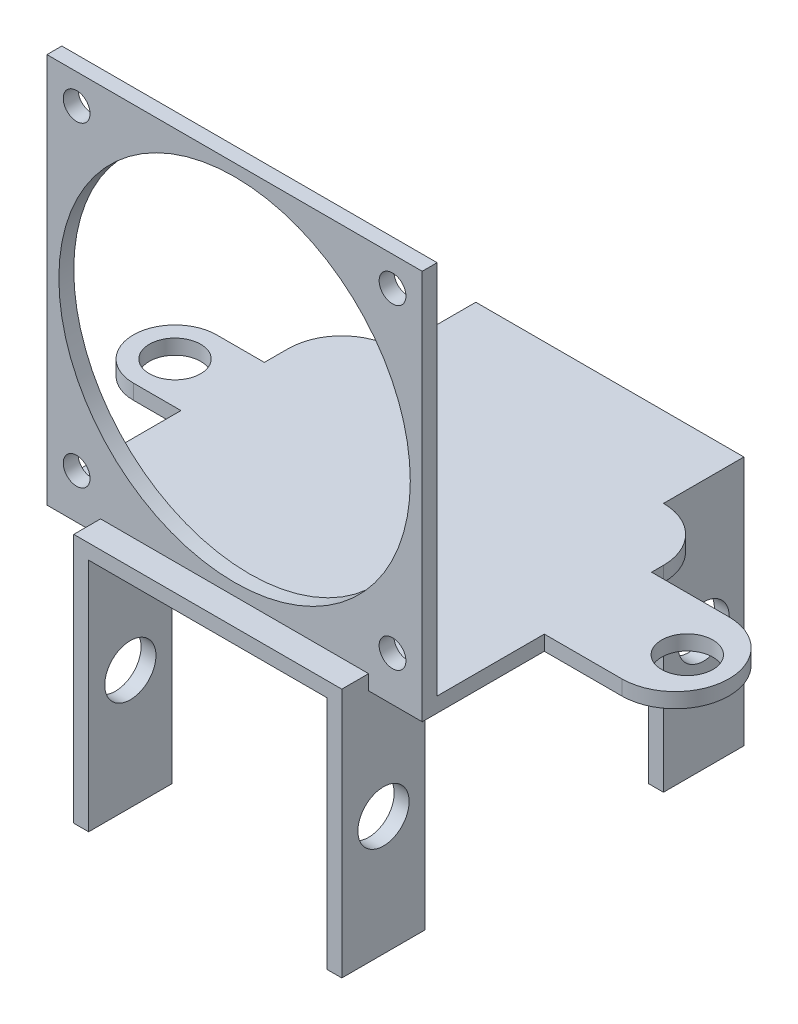
from build123d import *

# Parameters (mm, degrees)
SKETCH_1_R           = 29.5
SKETCH_1_R_2         = 2.25
EXTRUDE_1_DEPTH      = 2.5
EXTRUDE_2_DEPTH      = 2.5
SKETCH_3_W           = 2.5
SKETCH_3_H           = 20.5
SKETCH_3_H_2         = 29.5
EXTRUDE_3_DEPTH      = 42
SKETCH_4_W           = 15.5
SKETCH_4_H           = 42
SKETCH_4_W_2         = 6
CUT_EXTRUDE_1_DEPTH  = 60
SKETCH_5_R           = 4.3
EXTRUDE_4_DEPTH      = 2.5
CUT_EXTRUDE_9_DEPTH  = 122.813381989
EXTRUDE_6_DEPTH      = 2.5
SKETCH_14_R          = 4.3
CUT_EXTRUDE_10_DEPTH = 118.573381341
FILLET_3_R           = 9


with BuildPart() as part:
    # 草图1 → 凸台-拉伸1 (new body)
    with BuildSketch(Plane.XY):
        Polygon((0, 31.5), (31.5, 31.5), (31.5, -34), (-31.5, -34), (-31.5, 31.5), align=None)
        Circle(SKETCH_1_R, mode=Mode.SUBTRACT)
        with Locations((-26.516504294, 26.516504294)):
            Circle(SKETCH_1_R_2, mode=Mode.SUBTRACT)
        with Locations((26.516504294, 26.516504294)):
            Circle(SKETCH_1_R_2, mode=Mode.SUBTRACT)
        with Locations((26.516504294, -26.516504294)):
            Circle(SKETCH_1_R_2, mode=Mode.SUBTRACT)
        with Locations((-26.516504294, -26.516504294)):
            Circle(SKETCH_1_R_2, mode=Mode.SUBTRACT)
    extrude(amount=EXTRUDE_1_DEPTH)

    # 草图2 → 凸台-拉伸2 (add)
    with BuildSketch(Plane(origin=(0, -34, 0), x_dir=(1, 0, 0), z_dir=(0, 1, 0))):
        Polygon((-31.5, 46.5), (-31.5, -2.5), (-20, -2.5), (-20, -22.5), (20, -22.5), (20, -2.5), (31.5, -2.5), (31.5, 46.5), (20, 46.5), (20, 66.5), (-20, 66.5), (-20, 46.5), align=None)
    extrude(amount=EXTRUDE_2_DEPTH)

    # 草图3 → 凸台-拉伸3 (add)
    with BuildSketch(Plane(origin=(0, -31.5, 0), x_dir=(1, 0, 0), z_dir=(0, 1, 0))):
        with Locations((21.25, 56.25)):
            Rectangle(SKETCH_3_W, SKETCH_3_H)
        with Locations((-21.25, 56.25)):
            Rectangle(SKETCH_3_W, SKETCH_3_H)
        with Locations((-21.25, -7.75)):
            Rectangle(SKETCH_3_W, SKETCH_3_H_2)
        with Locations((21.25, -7.75)):
            Rectangle(SKETCH_3_W, SKETCH_3_H_2)
    extrude(amount=-EXTRUDE_3_DEPTH)

    # 草图4 → 切除-拉伸1 (cut)
    with BuildSketch(Plane.ZY.offset(22.5)):
        with Locations((14.75, -52.5)):
            Rectangle(SKETCH_4_W, SKETCH_4_H)
        with Locations((-63.5, -52.5)):
            Rectangle(SKETCH_4_W_2, SKETCH_4_H)
    extrude(amount=-CUT_EXTRUDE_1_DEPTH, mode=Mode.SUBTRACT)

    # 草图5 → 凸台-拉伸4 (add)
    # profile 1 of 2: a face of its own
    with BuildSketch(Plane(origin=(0, -31.5, 0), x_dir=(1, 0, 0), z_dir=(0, 1, 0))):
        with BuildLine():
            Line((-31.5, 33.999994356), (-39.5, 33.999994356))
            ThreePointArc((-39.5, 33.999994356), (-46.499999777, 27.00176014), (-39.503531569, 19.999995247))
            Line((-39.503531569, 19.999995247), (-31.5, 19.999995247))
            Line((-31.5, 19.999995247), (-31.5, 33.999994356))
        make_face()
        with Locations(Location((-39.5, 26.999994356, 0), (0, 0, 270))):
            Circle(SKETCH_5_R, mode=Mode.SUBTRACT)
    # profile 2 of 2: a face of its own
    with BuildSketch(Plane(origin=(0, -31.5, 0), x_dir=(1, 0, 0), z_dir=(0, 1, 0))):
        with BuildLine():
            Line((44.500000207, 35.999994356), (31.5, 35.999994356))
            Line((31.5, 35.999994356), (31.5, 26.5))
            Line((31.5, 26.5), (31.5, 17.999994356))
            Line((31.5, 17.999994356), (44.500000207, 17.999994356))
            ThreePointArc((44.500000207, 17.999994356), (53.500000207, 26.999994356), (44.500000207, 35.999994356))
        make_face()
        with Locations(Location((46.5, 26.999994356, 0), (0, 0, 270))):
            Circle(SKETCH_5_R, mode=Mode.SUBTRACT)
    extrude(amount=-EXTRUDE_4_DEPTH)

    # 草图12 → 切除-拉伸9 (cut, through all)
    with BuildSketch(Plane.ZY.offset(22.5)):
        Polygon((-46, -73.5), (-47, -73.5), (-47, -31.5), (-46.5, -31.5), (-46, -31.5), align=None)
    extrude(amount=-CUT_EXTRUDE_9_DEPTH, mode=Mode.SUBTRACT)


with BuildPart() as cut_extrude_9_piece_1:
    # of the separate pieces the step leaves, piece 1, a body of its own (cut_extrude_9_pieces)
    add(part.part.solids().sort_by_distance((31.5, 31.5, 0))[0])



with BuildPart() as cut_extrude_9_piece_2:
    # of the separate pieces the step leaves, piece 2, a body of its own (cut_extrude_9_pieces)
    add(part.part.solids().sort_by_distance((-22.5, -31.5, -60.5))[0])


with BuildPart() as cut_extrude_9_piece_1_1:
    add(cut_extrude_9_piece_1.part)

    add(cut_extrude_9_piece_2.part)  # 凸台-拉伸6 merges 切除-拉伸9 piece 2
    # 草图13 → 凸台-拉伸6 (add)
    with BuildSketch(Plane(origin=(0, -31.5, 0), x_dir=(1, 0, 0), z_dir=(0, 1, 0))):
        Polygon((31.5, 46.5), (31.5, 47), (22.5, 47), (-22.5, 47), (-31.5, 47), (-31.5, 46.5), (-22.5, 46.5), (-22.5, 46), (31.5, 46), align=None)
    extrude(amount=-EXTRUDE_6_DEPTH)

    # 草图14 → 切除-拉伸10 (cut, through all)
    with BuildSketch(Plane(origin=(22.5, 0, 0), x_dir=(0, 0, -1), z_dir=(1, 0, 0))):
        with Locations((0, -53.5)):
            Circle(SKETCH_14_R)
        with Locations((53.75, -53.5)):
            Circle(SKETCH_14_R)
    extrude(amount=-CUT_EXTRUDE_10_DEPTH, mode=Mode.SUBTRACT)

    # 圆角3
    fillet_3_edges = [cut_extrude_9_piece_1_1.edges().sort_by_distance(p)[0] for p in [
        (-31.5, -32.75, -47),
        (31.5, -32.75, -47),
    ]]
    fillet(fillet_3_edges, radius=FILLET_3_R - 0.0001)  # a hair under: the kernel refuses the full size


solid = cut_extrude_9_piece_1_1.part
